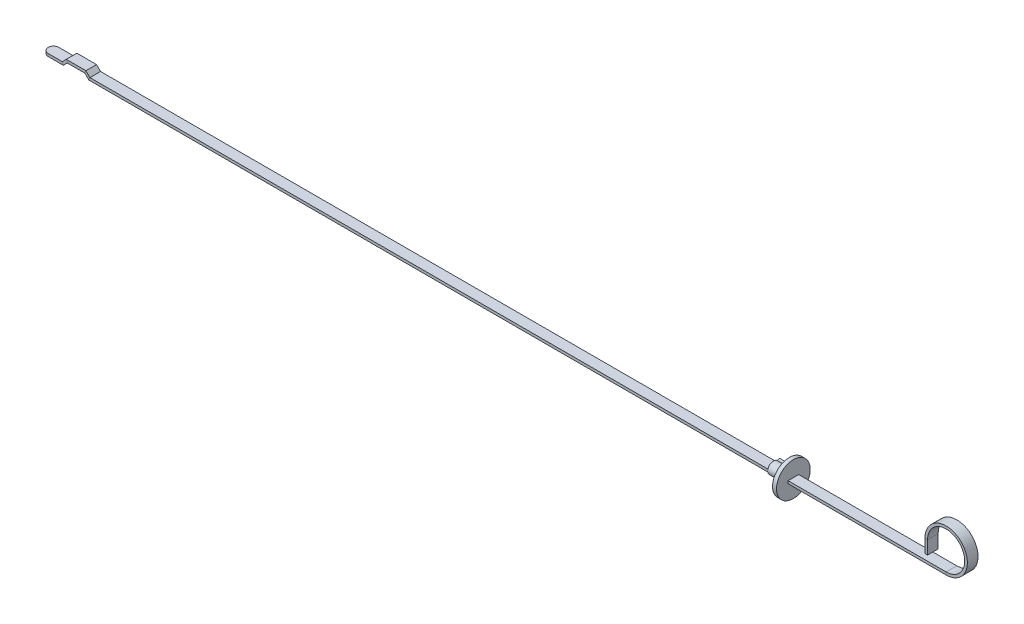
from build123d import *

# Parameters (mm, degrees)
SZKIC6_R                    = 12.7
DODANIE_WYCI_GNI_CIE3_DEPTH = 3
SZKIC7_W                    = 8
SZKIC7_H                    = 2
ZAOKR_GLENIE3_R             = 4
SZKIC13_W                   = 2
SZKIC13_H                   = 5
DODANIE_WYCI_GNI_CIE5_DEPTH = 2
DODANIE_WYCI_GNI_CIE6_START = -5
DODANIE_WYCI_GNI_CIE6_DEPTH = 5


with BuildPart() as part:
    # Szkic5 → Obrót1 (revolve)
    with BuildSketch(Plane.XY):
        with BuildLine():
            Line((0, 6.35), (1, 6.35))
            ThreePointArc((1, 6.35), (2, 5.35), (3, 6.35))
            Line((3, 6.35), (3, 0))
            Line((3, 0), (0, 0))
            Line((0, 0), (-9, 0))
            Line((-9, 0), (-9, 4.35))
            Line((-9, 4.35), (0, 4.35))
            Line((0, 4.35), (0, 6.35))
        make_face()
    revolve(axis=Axis((0, 0, 0), (-1, 0, 0)))

    # Szkic6 → Dodanie-wyciągnięcie3 (add)
    with BuildSketch(Plane(origin=(3, 0, 0), x_dir=(0, 0, -1), z_dir=(1, 0, 0))):
        with Locations(Location((0, 0, 0), (0, 0, 90))):
            Circle(SZKIC6_R)
    extrude(amount=DODANIE_WYCI_GNI_CIE3_DEPTH)

    # Wyciągnięcie po ścieżce1: sweep along a path in Szkic1
    with BuildLine(Plane.XY) as wyci_gni_cie_po_cie_ce1_path:
        Line((110, 5), (110, 15))
        ThreePointArc((110, 15), (135.606601718, 25.606601718), (125, 0))
        Line((125, 0), (0, 0))
        Line((0, 0), (-520, 0))
        Line((-520, 0), (-523, 3))
        Line((-523, 3), (-537, 3))
        Line((-537, 3), (-540, 0))
        Line((-540, 0), (-555, 0))
    # Szkic7 → Wyciągnięcie po ścieżce1 (sweep)
    with BuildSketch(Plane(origin=(0, 0, 0), x_dir=(0, 0, -1), z_dir=(1, 0, 0))):
        Rectangle(SZKIC7_W, SZKIC7_H)
    sweep(path=wyci_gni_cie_po_cie_ce1_path.line, transition=Transition.RIGHT)

    # Zaokrąglenie3
    zaokr_glenie3_edges = [part.edges().sort_by_distance(p)[0] for p in [
        (-555, 0, -4),
        (-555, 0, 4),
    ]]
    fillet(zaokr_glenie3_edges, radius=ZAOKR_GLENIE3_R - 0.0001)  # a hair under: the kernel refuses the full size

    # Szkic13 → Dodanie-wyciągnięcie5 (add)
    with BuildSketch(Plane.ZY.offset(9)):
        with Locations((0, -2.5)):
            Rectangle(SZKIC13_W, SZKIC13_H)
    extrude(amount=-DODANIE_WYCI_GNI_CIE5_DEPTH)

    # Szkic14 → Dodanie-wyciągnięcie6 (add)
    with BuildSketch(Plane.ZY.offset(9).offset(DODANIE_WYCI_GNI_CIE6_START)):
        with BuildLine():
            Line((-2.94595959, 3.200597147), (-4.631919427, 3.814236344))
            Line((-4.631919427, 3.814236344), (-6, 0.055465861))
            Line((-6, 0.055465861), (-4.314040163, -0.558173336))
            ThreePointArc((-4.314040163, -0.558173336), (-4.0876629, 1.487787623), (-2.94595959, 3.200597147))
        make_face()
    extrude(amount=DODANIE_WYCI_GNI_CIE6_DEPTH)


solid = part.part
